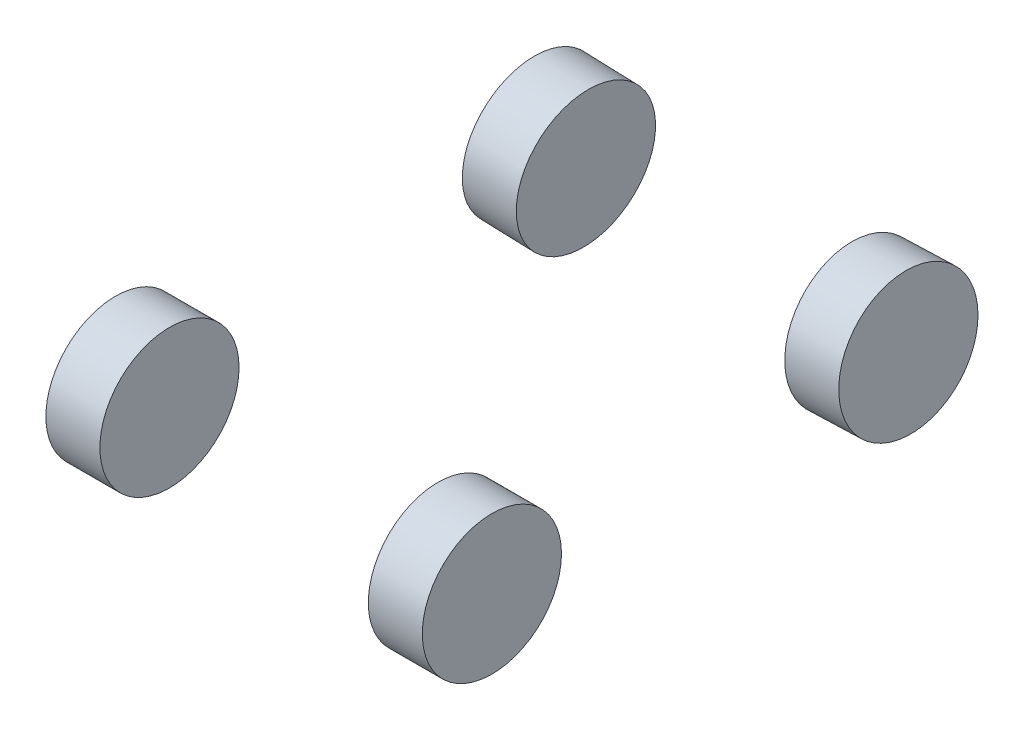
from build123d import *

# Parameters (mm, degrees)
BOSS_EXTRUDE2_DEPTH      = 100.5
BOSS_EXTRUDE2_DEPTH_BACK = 100.5
F_3DSKETCH2_R            = 259
BOSS_EXTRUDE3_DEPTH      = 100.5
BOSS_EXTRUDE3_DEPTH_BACK = 100.5
F_3DSKETCH1_R            = 259


with BuildPart() as part:
    # 3DSketch2 → Boss-Extrude2 (new, two sides: drawn at the far end of the back side and taken through both)
    with BuildSketch(Plane(origin=(-600.035357699, 235.001234718, 530), x_dir=(0, 0, 1), z_dir=(0.9993908270190958, -0.034899496702500726, 0)).offset(-BOSS_EXTRUDE2_DEPTH_BACK)):
        Circle(F_3DSKETCH2_R)
    extrude(amount=BOSS_EXTRUDE2_DEPTH + BOSS_EXTRUDE2_DEPTH_BACK)


with BuildPart() as body_2:
    # 3DSketch1 → Boss-Extrude3 (new, two sides: drawn at the far end of the back side and taken through both)
    with BuildSketch(Plane(origin=(-600, 235, 2080), x_dir=(0, -1, 0), z_dir=(1, 0, 0)).offset(-BOSS_EXTRUDE3_DEPTH_BACK)):
        Circle(F_3DSKETCH1_R)
    extrude(amount=BOSS_EXTRUDE3_DEPTH + BOSS_EXTRUDE3_DEPTH_BACK)


with BuildPart() as body_3:
    # Mirror1: mirrored copy
    add(part.part.mirror(Plane(origin=(0, 0, 0), x_dir=(0, 0, 1), z_dir=(1, 0, 0))))


with BuildPart() as body_4:
    # Mirror1 2: mirrored copy
    add(body_2.part.mirror(Plane(origin=(0, 0, 0), x_dir=(0, 0, 1), z_dir=(1, 0, 0))))


solid = Compound([part.part, body_2.part, body_3.part, body_4.part])
